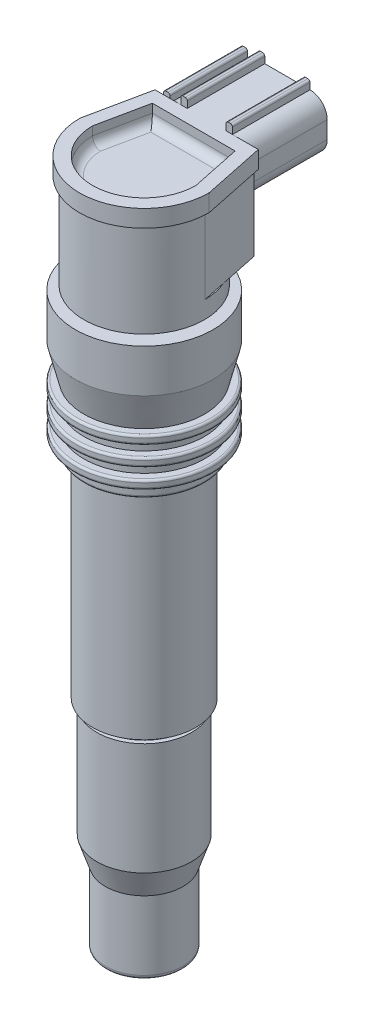
from build123d import *
from OCP.BRepFilletAPI import BRepFilletAPI_MakeChamfer

# Parameters (mm, degrees)
EXTRUDE1_START     = 14.2875
EXTRUDE1_DEPTH     = 14.2875
EXTRUDE2_DEPTH     = 3.175
CUT_EXTRUDE1_DEPTH = 3.175
FILLET1_R          = 1.5875
EXTRUDE3_DEPTH     = 14.2875
CUT_EXTRUDE6_DEPTH = 6.35
CUT_EXTRUDE7_DEPTH = 7.9375
SKETCH10_W         = 3.175
SKETCH10_H         = 0.79375
EXTRUDE5_DEPTH     = 9.525
CHAMFER1_SIZE      = 1.5875
CHAMFER1_SIZE2     = 0.916543552
EXTRUDE6_START     = -14.2875
EXTRUDE6_DEPTH     = 14.2875


with BuildPart() as part:
    # Sketch1 → Revolve1 (revolve)
    with BuildSketch(Plane.XY, mode=Mode.PRIVATE) as revolve1_sk:
        with BuildLine():
            Line((0, 8.89), (1.769045474, 8.89))
            Line((1.769045474, 8.89), (3.96875, 10.16))
            Line((3.96875, 10.16), (3.96875, -7.623717928))
            ThreePointArc((3.96875, -7.623717928), (4.201233992, -8.184983936), (4.7625, -8.417467928))
            Line((4.7625, -8.417467928), (6.35, -8.417467928))
            ThreePointArc((6.35, -8.417467928), (6.911266008, -8.184983936), (7.14375, -7.623717928))
            Line((7.14375, -7.623717928), (7.14375, 5.076282072))
            Line((7.14375, 5.076282072), (8.73125, 9.838782072))
            Line((8.73125, 9.838782072), (8.73125, 30.476282072))
            Line((8.73125, 30.476282072), (7.9375, 30.476282072))
            Line((7.9375, 30.476282072), (8.73125, 31.666907072))
            Line((8.73125, 31.666907072), (9.525, 31.666907072))
            Line((9.525, 31.666907072), (9.525, 71.354407072))
            Line((9.525, 71.354407072), (10.715625, 71.354407072))
            ThreePointArc((10.715625, 71.354407072), (10.996258004, 71.470649068), (11.1125, 71.751282072))
            Line((11.1125, 71.751282072), (11.1125, 73.735657072))
            Line((11.1125, 73.735657072), (12.303125, 73.735657072))
            ThreePointArc((12.303125, 73.735657072), (12.583758004, 73.851899068), (12.7, 74.132532072))
            Line((12.7, 74.132532072), (12.7, 74.926282072))
            ThreePointArc((12.7, 74.926282072), (12.583758004, 75.206915075), (12.303125, 75.323157072))
            Line((12.303125, 75.323157072), (11.1125, 75.323157072))
            Line((11.1125, 75.323157072), (11.1125, 77.307532072))
            Line((11.1125, 77.307532072), (12.303125, 77.307532072))
            ThreePointArc((12.303125, 77.307532072), (12.583758004, 77.423774068), (12.7, 77.704407072))
            Line((12.7, 77.704407072), (12.7, 78.498157072))
            ThreePointArc((12.7, 78.498157072), (12.583758004, 78.778790075), (12.303125, 78.895032072))
            Line((12.303125, 78.895032072), (11.1125, 78.895032072))
            Line((11.1125, 78.895032072), (11.1125, 80.879407072))
            Line((11.1125, 80.879407072), (12.303125, 80.879407072))
            ThreePointArc((12.303125, 80.879407072), (12.583758004, 80.995649068), (12.7, 81.276282072))
            Line((12.7, 81.276282072), (12.7, 82.070032072))
            ThreePointArc((12.7, 82.070032072), (12.583758004, 82.350665075), (12.303125, 82.466907072))
            Line((12.303125, 82.466907072), (11.1125, 82.466907072))
            Line((11.1125, 82.466907072), (12.7, 88.816907072))
            Line((12.7, 88.816907072), (12.7, 96.754407072))
            Line((12.7, 96.754407072), (9.525, 96.754407072))
            Line((9.525, 96.754407072), (9.525, 97.548157072))
            Line((9.525, 97.548157072), (11.1125, 97.548157072))
            Line((11.1125, 97.548157072), (11.1125, 100.723157072))
            Line((11.1125, 100.723157072), (0, 100.723157072))
            Line((0, 100.723157072), (0, 8.89))
        make_face()
    revolve(revolve1_sk.sketch.rotate(Axis((0, -41.455838842, 0), (0, 1, 0)), 90), axis=Axis((0, -41.455838842, 0), (0, 1, 0)))

    # Sketch2 → Extrude1 (add)
    with BuildSketch(Plane(origin=(0, 100.723157072, 0), x_dir=(-1, 0, 0), z_dir=(0, 1, 0)).offset(EXTRUDE1_START)):
        with BuildLine():
            Line((8.73125, -11.509375), (-8.73125, -11.509375))
            Line((-8.73125, -11.509375), (-11.112216514, -0.079375))
            ThreePointArc((-11.112216514, -0.079375), (0, 11.1125), (11.112216514, -0.079375))
            Line((11.112216514, -0.079375), (8.73125, -11.509375))
        make_face()
    extrude(amount=-EXTRUDE1_DEPTH)

    # Sketch3 → Extrude2 (add)
    with BuildSketch(Plane(origin=(0, 115.010657072, 0), x_dir=(-1, 0, 0), z_dir=(0, 1, 0))):
        with BuildLine():
            Line((9.525, -11.509375), (-9.525, -11.509375))
            Line((-9.525, -11.509375), (-11.905986038, -0.079281274))
            ThreePointArc((-11.905986038, -0.079281274), (0, 11.90625), (11.905986038, -0.079281274))
            Line((11.905986038, -0.079281274), (9.525, -11.509375))
        make_face()
    extrude(amount=EXTRUDE2_DEPTH)

    # Sketch4 → Cut-Extrude1 (cut)
    with BuildSketch(Plane(origin=(0, 118.185657072, 0), x_dir=(-1, 0, 0), z_dir=(0, 1, 0))):
        with BuildLine():
            Line((9.525, 0), (7.623533687, -9.128125))
            Line((7.623533687, -9.128125), (-7.623533687, -9.128125))
            Line((-7.623533687, -9.128125), (-9.525, 0))
            ThreePointArc((-9.525, 0), (0, 9.525), (9.525, 0))
        make_face()
    extrude(amount=-CUT_EXTRUDE1_DEPTH, mode=Mode.SUBTRACT)

    # Fillet1
    # the kernel refuses this fillet: 1.5875 mm, written as the material it adds along each edge
    with BuildSketch(Plane(origin=(0, 115.010657072, 0), x_dir=(0.9860987307491407, 0, -0.1661604441945603), z_dir=(-0.1661604441945603, 0, -0.9860987307491407))) as fillet1_piece_1:
        with BuildLine():
            CenterArc((9.525 - FILLET1_R, -FILLET1_R), FILLET1_R, 0, 90)
            Line((9.525 - FILLET1_R, 0), (9.525 - FILLET1_R, FILLET1_R * 0.02))
            Line((9.525 - FILLET1_R, FILLET1_R * 0.02), (9.525 + FILLET1_R * 0.02, FILLET1_R * 0.02))
            Line((9.525 + FILLET1_R * 0.02, FILLET1_R * 0.02), (9.525 + FILLET1_R * 0.02, -FILLET1_R))
            Line((9.525 + FILLET1_R * 0.02, -FILLET1_R), (9.525, -FILLET1_R))
        make_face()
    revolve(axis=Axis((0, 115.010657072, 0), (0, -1, 0)), revolution_arc=199.12930732)
    with BuildSketch(Plane(origin=(-9.848740436, 115.010657072, 1.554139112), x_dir=(0, 1, 0), z_dir=(0.203930983368504, 0, -0.9789852675205869)), Plane(origin=(7.29979325, 115.010657072, -10.682264112), x_dir=(0, 1, 0), z_dir=(0.20393098336850368, 0, 0.9789852675205869))) as fillet1_piece_2:
        with BuildLine():
            CenterArc((FILLET1_R, FILLET1_R), FILLET1_R, 180, 90)
            Line((0, FILLET1_R), (-FILLET1_R * 0.02, FILLET1_R))
            Line((-FILLET1_R * 0.02, FILLET1_R), (-FILLET1_R * 0.02, -FILLET1_R * 0.02))
            Line((-FILLET1_R * 0.02, -FILLET1_R * 0.02), (FILLET1_R, -FILLET1_R * 0.02))
            Line((FILLET1_R, -FILLET1_R * 0.02), (FILLET1_R, 0))
        make_face()
    extrude(amount=12.49906779)
    with BuildSketch(Plane(origin=(-9.211033687, 115.010657072, -9.128125), x_dir=(0, 1, 0), z_dir=(1, 0, 0))) as fillet1_piece_3:
        with BuildLine():
            CenterArc((FILLET1_R, FILLET1_R), FILLET1_R, 180, 90)
            Line((0, FILLET1_R), (-FILLET1_R * 0.02, FILLET1_R))
            Line((-FILLET1_R * 0.02, FILLET1_R), (-FILLET1_R * 0.02, -FILLET1_R * 0.02))
            Line((-FILLET1_R * 0.02, -FILLET1_R * 0.02), (FILLET1_R, -FILLET1_R * 0.02))
            Line((FILLET1_R, -FILLET1_R * 0.02), (FILLET1_R, 0))
        make_face()
    extrude(amount=18.422067373)

    # Sketch5 → Extrude3 (add)
    with BuildSketch(Plane(origin=(0, 0, -11.509375), x_dir=(-1, 0, 0), z_dir=(0, 0, -1))):
        with BuildLine():
            Line((-4.7625, 118.185657072), (4.7625, 118.185657072))
            ThreePointArc((4.7625, 118.185657072), (7.00756403, 117.255721102), (7.9375, 115.010657072))
            Line((7.9375, 115.010657072), (7.9375, 111.835657072))
            ThreePointArc((7.9375, 111.835657072), (7.00756403, 109.590593041), (4.7625, 108.660657072))
            Line((4.7625, 108.660657072), (-4.7625, 108.660657072))
            ThreePointArc((-4.7625, 108.660657072), (-7.00756403, 109.590593041), (-7.9375, 111.835657072))
            Line((-7.9375, 111.835657072), (-7.9375, 115.010657072))
            ThreePointArc((-7.9375, 115.010657072), (-7.00756403, 117.255721102), (-4.7625, 118.185657072))
        make_face()
    extrude(amount=EXTRUDE3_DEPTH)

    # Sketch8 → Cut-Extrude6 (cut)
    with BuildSketch(Plane(origin=(0, 0, -25.796875), x_dir=(-1, 0, 0), z_dir=(0, 0, -1))):
        with BuildLine():
            Line((4.7625, 117.391907072), (-4.7625, 117.391907072))
            ThreePointArc((-4.7625, 117.391907072), (-6.446298023, 116.694455094), (-7.14375, 115.010657072))
            Line((-7.14375, 115.010657072), (-7.14375, 111.835657072))
            ThreePointArc((-7.14375, 111.835657072), (-6.446298023, 110.151859049), (-4.7625, 109.454407072))
            Line((-4.7625, 109.454407072), (4.7625, 109.454407072))
            ThreePointArc((4.7625, 109.454407072), (6.446298023, 110.151859049), (7.14375, 111.835657072))
            Line((7.14375, 111.835657072), (7.14375, 115.010657072))
            ThreePointArc((7.14375, 115.010657072), (6.446298023, 116.694455094), (4.7625, 117.391907072))
        make_face()
    extrude(amount=-CUT_EXTRUDE6_DEPTH, mode=Mode.SUBTRACT)

    # Sketch9 → Cut-Extrude7 (cut)
    with BuildSketch(Plane(origin=(0, 0, -19.446875), x_dir=(-1, 0, 0), z_dir=(0, 0, -1))):
        with BuildLine():
            Line((4.7625, 116.598157072), (-4.7625, 116.598157072))
            ThreePointArc((-4.7625, 116.598157072), (-5.885032015, 116.133189087), (-6.35, 115.010657072))
            Line((-6.35, 115.010657072), (-6.35, 111.835657072))
            ThreePointArc((-6.35, 111.835657072), (-5.885032015, 110.713125056), (-4.7625, 110.248157072))
            Line((-4.7625, 110.248157072), (4.7625, 110.248157072))
            ThreePointArc((4.7625, 110.248157072), (5.885032015, 110.713125056), (6.35, 111.835657072))
            Line((6.35, 111.835657072), (6.35, 115.010657072))
            ThreePointArc((6.35, 115.010657072), (5.885032015, 116.133189087), (4.7625, 116.598157072))
        make_face()
    extrude(amount=-CUT_EXTRUDE7_DEPTH, mode=Mode.SUBTRACT)

    # Sketch10 → Extrude5 (add)
    with BuildSketch(Plane(origin=(0, 0, -11.509375), x_dir=(-1, 0, 0), z_dir=(0, 0, -1))):
        with Locations((-3.175, 112.061729045)):
            Rectangle(SKETCH10_W, SKETCH10_H)
        with Locations((3.175, 112.061729045)):
            Rectangle(SKETCH10_W, SKETCH10_H)
    extrude(amount=EXTRUDE5_DEPTH)

    # Chamfer1: one chamfer whose edges measure the first distance from different faces: ONE call of the kernel's chamfer builder (chamfer() names one face for all edges)
    chamfer1_edges_1 = [part.edges().sort_by_distance(p)[0] for p in [
        (4.7625, 112.061729045, -21.034375),
    ]]
    chamfer1_side_1 = [part.faces().sort_by_distance(p)[0] for p in [
        (4.7625, 112.061729045, -16.271875),
    ]]
    chamfer1_edges_2 = [part.edges().sort_by_distance(p)[0] for p in [
        (1.5875, 112.061729045, -21.034375),
    ]]
    chamfer1_side_2 = [part.faces().sort_by_distance(p)[0] for p in [
        (1.5875, 112.061729045, -16.271875),
    ]]
    chamfer1_edges_3 = [part.edges().sort_by_distance(p)[0] for p in [
        (-4.7625, 112.061729045, -21.034375),
    ]]
    chamfer1_side_3 = [part.faces().sort_by_distance(p)[0] for p in [
        (-4.7625, 112.061729045, -16.271875),
    ]]
    chamfer1_edges_4 = [part.edges().sort_by_distance(p)[0] for p in [
        (-1.5875, 112.061729045, -21.034375),
    ]]
    chamfer1_side_4 = [part.faces().sort_by_distance(p)[0] for p in [
        (-1.5875, 112.061729045, -16.271875),
    ]]
    chamfer1 = BRepFilletAPI_MakeChamfer(part.part.solid().wrapped)
    for e in chamfer1_edges_1:
        chamfer1.Add(CHAMFER1_SIZE, CHAMFER1_SIZE2, e.wrapped, chamfer1_side_1[0].wrapped)  # the first distance lies on this face
    for e in chamfer1_edges_2:
        chamfer1.Add(CHAMFER1_SIZE, CHAMFER1_SIZE2, e.wrapped, chamfer1_side_2[0].wrapped)  # the first distance lies on this face
    for e in chamfer1_edges_3:
        chamfer1.Add(CHAMFER1_SIZE, CHAMFER1_SIZE2, e.wrapped, chamfer1_side_3[0].wrapped)  # the first distance lies on this face
    for e in chamfer1_edges_4:
        chamfer1.Add(CHAMFER1_SIZE, CHAMFER1_SIZE2, e.wrapped, chamfer1_side_4[0].wrapped)  # the first distance lies on this face
    add(Compound.cast(chamfer1.Shape()), mode=Mode.REPLACE)

    # Sketch11 → Extrude6 (add)
    with BuildSketch(Plane(origin=(0, 0, -25.796875), x_dir=(-1, 0, 0), z_dir=(0, 0, -1)).offset(EXTRUDE6_START)):
        with BuildLine():
            Line((7.9375, 115.010657072), (7.9375, 118.582532072))
            ThreePointArc((7.9375, 118.582532072), (7.821258004, 118.863165075), (7.540625, 118.979407072))
            Line((7.540625, 118.979407072), (7.14375, 118.979407072))
            ThreePointArc((7.14375, 118.979407072), (6.863116996, 118.863165075), (6.746875, 118.582532072))
            Line((6.746875, 118.582532072), (6.746875, 117.489140652))
            ThreePointArc((6.746875, 117.489140652), (7.624406325, 116.3854724), (7.9375, 115.010657072))
        make_face()
        with BuildLine():
            Line((-4.7625, 118.185657072), (-3.571875, 118.185657072))
            Line((-3.571875, 118.185657072), (-3.571875, 119.376282072))
            ThreePointArc((-3.571875, 119.376282072), (-3.688116996, 119.656915075), (-3.96875, 119.773157072))
            Line((-3.96875, 119.773157072), (-4.365625, 119.773157072))
            ThreePointArc((-4.365625, 119.773157072), (-4.646258004, 119.656915075), (-4.7625, 119.376282072))
            Line((-4.7625, 119.376282072), (-4.7625, 118.185657072))
        make_face()
        with BuildLine():
            Line((4.7625, 118.185657072), (3.571875, 118.185657072))
            Line((3.571875, 118.185657072), (3.571875, 119.376282072))
            ThreePointArc((3.571875, 119.376282072), (3.688116996, 119.656915075), (3.96875, 119.773157072))
            Line((3.96875, 119.773157072), (4.365625, 119.773157072))
            ThreePointArc((4.365625, 119.773157072), (4.646258004, 119.656915075), (4.7625, 119.376282072))
            Line((4.7625, 119.376282072), (4.7625, 118.185657072))
        make_face()
    extrude(amount=EXTRUDE6_DEPTH)


solid = part.part
